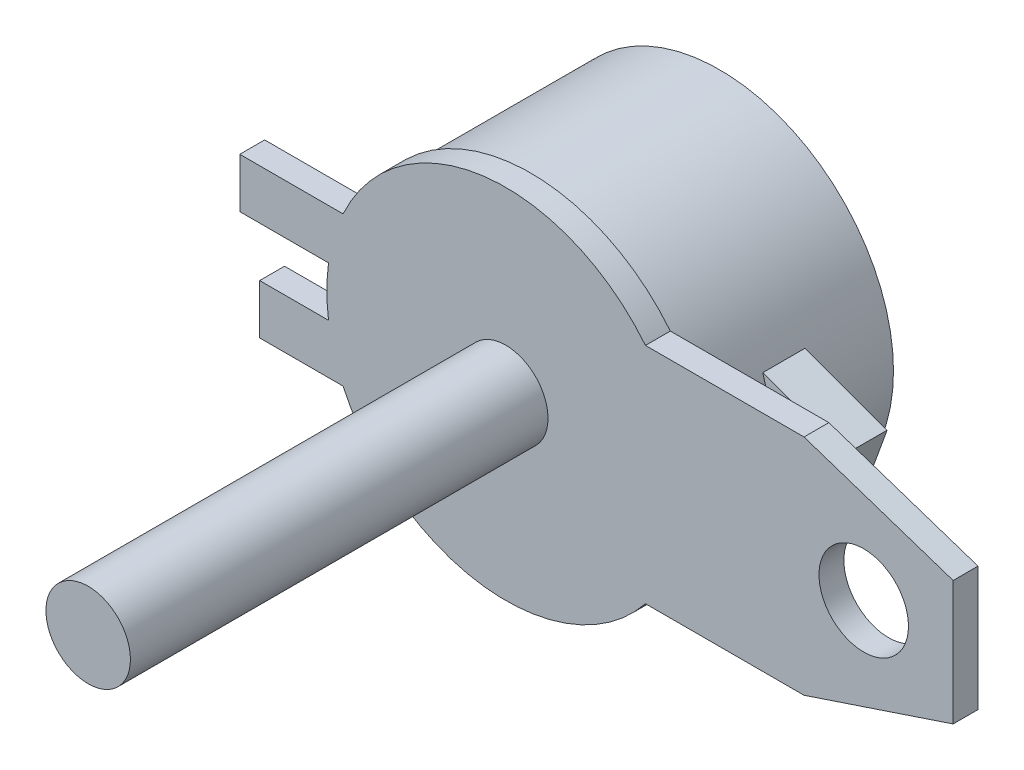
from build123d import *

# Parameters (mm, degrees)
SKETCH_2_R      = 3.5
EXTRUDE_2_DEPTH = 4.3
SKETCH_5_R      = 0.9
EXTRUDE_3_DEPTH = 0.5
SKETCH_6_R      = 0.85
EXTRUDE_4_DEPTH = 8.4
EXTRUDE_START   = -2.7
EXTRUDE_5_DEPTH = 0.85


with BuildPart() as part:
    # Эскиз2 → Бобышка-Вытянуть2 (new body)
    with BuildSketch(Plane.XY):
        Circle(SKETCH_2_R)
    extrude(amount=EXTRUDE_2_DEPTH)

    # Эскиз5 → Бобышка-Вытянуть3 (add)
    with BuildSketch(Plane.XY.offset(4.3)):
        with BuildLine():
            Line((-4.95, -1.5), (-4.95, -0.5))
            Line((-4.95, -0.5), (-3.565108694, -0.5))
            ThreePointArc((-3.565108694, -0.5), (-3.6, 0), (-3.565108694, 0.5))
            Line((-3.565108694, 0.5), (-5.35, 0.5))
            Line((-5.35, 0.5), (-5.35, 1.5))
            Line((-5.35, 1.5), (-3.272613634, 1.5))
            ThreePointArc((-3.272613634, 1.5), (-0.44053404, 3.57294413), (2.810249099, 2.25))
            Line((2.810249099, 2.25), (6, 2.25))
            Line((6, 2.25), (9, 1.25))
            Line((9, 1.25), (9, -1.25))
            Line((9, -1.25), (6, -2.25))
            Line((6, -2.25), (2.810249099, -2.25))
            ThreePointArc((2.810249099, -2.25), (-0.44053404, -3.57294413), (-3.272613634, -1.5))
            Line((-3.272613634, -1.5), (-4.95, -1.5))
        make_face()
        with Locations((7.201241972, 0.003317783)):
            Circle(SKETCH_5_R, mode=Mode.SUBTRACT)
    extrude(amount=-EXTRUDE_3_DEPTH)

    # Эскиз6 → Бобышка-Вытянуть4 (add)
    with BuildSketch(Plane.XY.offset(4.3)):
        Circle(SKETCH_6_R)
    extrude(amount=EXTRUDE_4_DEPTH)

    # Эскиз7 → Бобышка-Вытянуть5 (add)
    with BuildSketch(Plane.XY.offset(4.3).offset(EXTRUDE_START)):
        with BuildLine():
            Line((3.484722982, -3.582922095), (4.972510605, 0.504740805))
            Line((4.972510605, 0.504740805), (3.32066994, 1.105961639))
            ThreePointArc((3.32066994, 1.105961639), (3.288924173, -1.197070502), (1.832882317, -2.981701261))
            Line((1.832882317, -2.981701261), (3.484722982, -3.582922095))
        make_face()
    extrude(amount=EXTRUDE_5_DEPTH)


solid = part.part
